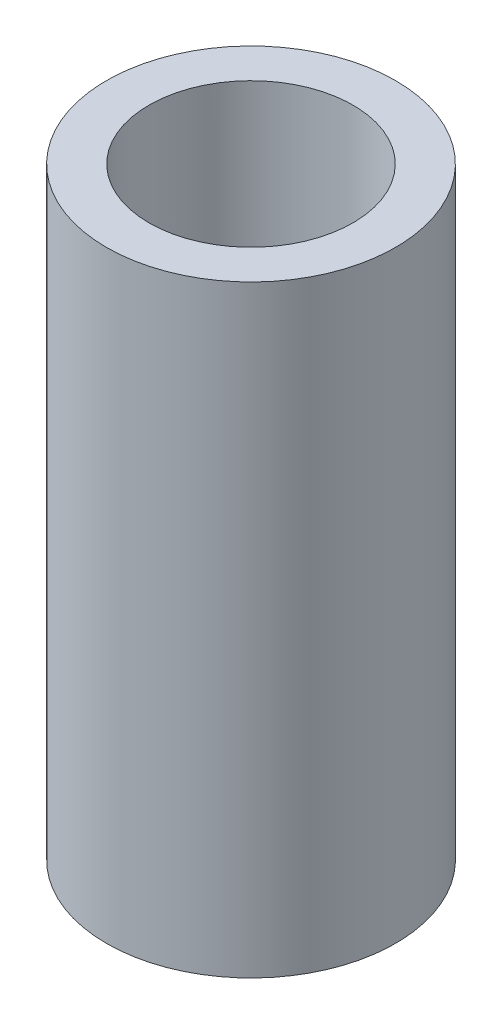
from build123d import *

# Parameters (mm, degrees)
SKETCH1_R           = 34
SKETCH1_R_2         = 24
BOSS_EXTRUDE1_DEPTH = 141.8
SKETCH2_R           = 12.53
CUT_EXTRUDE1_DEPTH  = 150.730558003


with BuildPart() as part:
    # Sketch1 → Boss-Extrude1 (new body)
    with BuildSketch(Plane(origin=(0, 0, 0), x_dir=(1, 0, 0), z_dir=(0, 1, 0))):
        Circle(SKETCH1_R)
        Circle(SKETCH1_R_2, mode=Mode.SUBTRACT)
    extrude(amount=BOSS_EXTRUDE1_DEPTH)

    # Sketch2 → Cut-Extrude1 (cut, through all)
    with BuildSketch(Plane(origin=(0, 0, 0), x_dir=(0, 0, -1), z_dir=(1, 0, 0))):
        with Locations((0, 24.6)):
            Circle(SKETCH2_R)
        with Locations((0, 77.6)):
            Circle(SKETCH2_R)
    extrude(amount=-CUT_EXTRUDE1_DEPTH, mode=Mode.SUBTRACT)


solid = part.part
